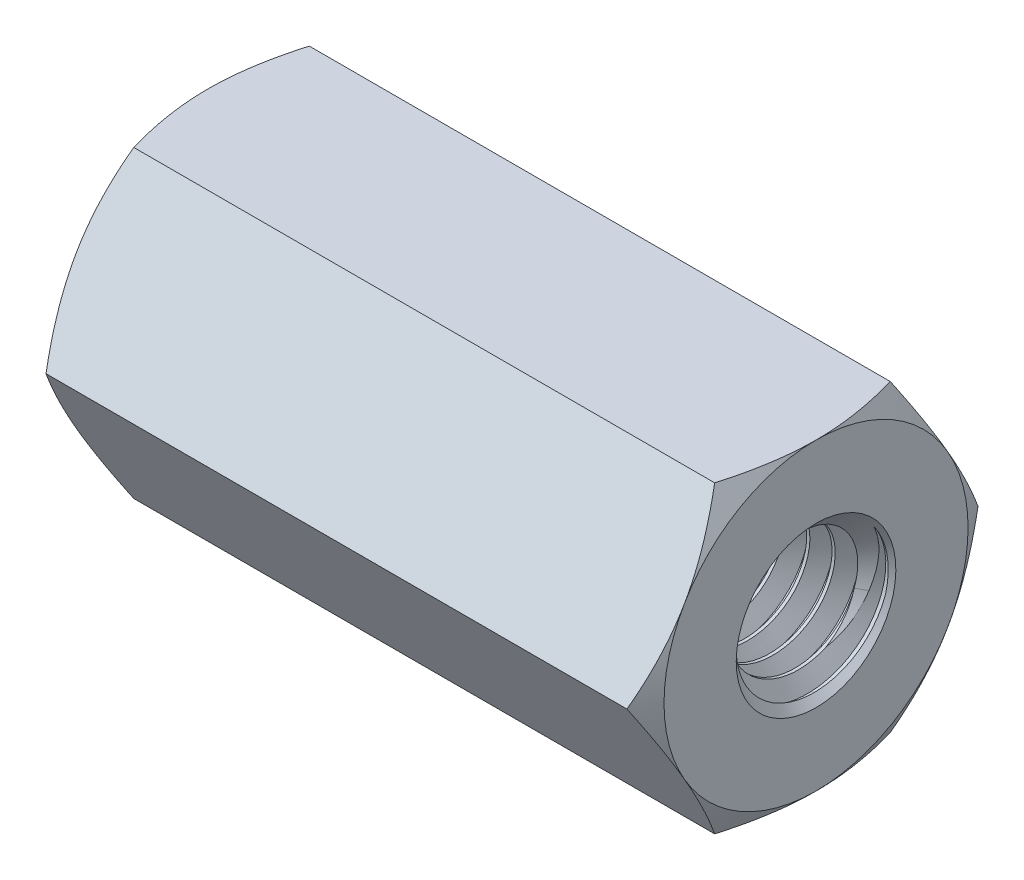
from build123d import *
from build123d.topology import SkipClean

# Parameters (mm, degrees)
BOSS_EXTRUDE1_DEPTH          = 12
SKETCH4_OUTSIDE_W            = 59.91
SKETCH4_OUTSIDE_H            = 58.982
SKETCH4_OUTSIDE_R            = 3
CUT_EXTRUDE1_DEPTH           = 13.845232579
CUT_EXTRUDE1_DRAFT           = -60
SKETCH5_OUTSIDE_W            = 59.91
SKETCH5_OUTSIDE_H            = 58.982
SKETCH5_OUTSIDE_R            = 3
CUT_EXTRUDE2_DEPTH           = 13.845232579
CUT_EXTRUDE2_DRAFT           = -60
SWEEP1_PITCH                 = 0.5
SWEEP1_HEIGHT                = 12.5
SWEEP1_RADIUS                = 1.5
SWEEP1_START_ANGLE           = -90
SKETCH8_R                    = 1.575
CUT_EXTRUDE3_OTHER_WAY_DEPTH = 14.330468218
CUT_EXTRUDE3_OTHER_WAY_TAPER = -45
SKETCH9_R                    = 1.575
CUT_EXTRUDE4_OTHER_WAY_DEPTH = 13.845232672
CUT_EXTRUDE4_OTHER_WAY_TAPER = -45


with BuildPart() as part:
    # Sketch2 → Boss-Extrude1 (new body)
    with BuildSketch(Plane(origin=(0, 0, 0), x_dir=(0, 0, -1), z_dir=(1, 0, 0))):
        Polygon((1.732050808, 3), (-1.732050808, 3), (-3.464101615, 0), (-1.732050808, -3), (1.732050808, -3), (3.464101615, 0), align=None)
    extrude(amount=BOSS_EXTRUDE1_DEPTH)

    # Sketch3 → Cut-Revolve1 (revolve, cut)
    with BuildSketch(Plane.XY, mode=Mode.PRIVATE) as cut_revolve1_sk:
        Polygon((0, 1.575), (0.075, 1.5), (11.925, 1.5), (12, 1.575), (12, 0), (0, 0), align=None)
    revolve(cut_revolve1_sk.sketch.rotate(Axis((0, 0, 0), (1, 0, 0)), 90), axis=Axis((0, 0, 0), (1, 0, 0)), mode=Mode.SUBTRACT)


with BuildPart() as cut_extrude1_tool:
    # Sketch4 outside → Cut-Extrude1 (with draft: the straight prism first)
    with BuildSketch(Plane.ZY):
        Rectangle(SKETCH4_OUTSIDE_W, SKETCH4_OUTSIDE_H)
        Circle(SKETCH4_OUTSIDE_R, mode=Mode.SUBTRACT)
    extrude(amount=-CUT_EXTRUDE1_DEPTH)
    # Cut-Extrude1: the draft: its side faces are tilted about the plane it starts from
    cut_extrude1_sides = [cut_extrude1_tool.faces().sort_by_distance(p)[0] for p in [
        (6.922616289, -29.491, 0),
        (6.922616289, 0, 29.955),
        (6.922616289, 29.491, 0),
        (6.922616289, 0, -29.955),
        (6.922616289, 0, -3),
    ]]
    draft(cut_extrude1_sides, Plane.ZY, CUT_EXTRUDE1_DRAFT)


with BuildPart() as part_1:
    add(part.part)

    # Cut-Extrude1: cut by cut_extrude1_tool
    add(cut_extrude1_tool.part, mode=Mode.SUBTRACT)


with BuildPart() as cut_extrude2_tool:
    # Sketch5 outside → Cut-Extrude2 (with draft: the straight prism first)
    with BuildSketch(Plane(origin=(12, 0, 0), x_dir=(0, 0, -1), z_dir=(1, 0, 0))):
        Rectangle(SKETCH5_OUTSIDE_W, SKETCH5_OUTSIDE_H)
        Circle(SKETCH5_OUTSIDE_R, mode=Mode.SUBTRACT)
    extrude(amount=-CUT_EXTRUDE2_DEPTH)
    # Cut-Extrude2: the draft: its side faces are tilted about the plane it starts from
    cut_extrude2_sides = [cut_extrude2_tool.faces().sort_by_distance(p)[0] for p in [
        (5.077383711, -29.491, 0),
        (5.077383711, 0, -29.955),
        (5.077383711, 29.491, 0),
        (5.077383711, 0, 29.955),
        (5.077383711, 0, 3),
    ]]
    draft(cut_extrude2_sides, Plane(origin=(12, 0, 0), x_dir=(0, 0, -1), z_dir=(1, 0, 0)), CUT_EXTRUDE2_DRAFT)


with BuildPart() as part_2:
    add(part_1.part)

    # Cut-Extrude2: cut by cut_extrude2_tool
    add(cut_extrude2_tool.part, mode=Mode.SUBTRACT)

    # Sweep1: sweep along a helix
    with BuildLine() as sweep1_path:
        add(Helix(SWEEP1_PITCH, SWEEP1_HEIGHT, SWEEP1_RADIUS, center=(0, 0, 0), direction=(1, 0, 0), mode=Mode.PRIVATE).rotate(Axis((0, 0, 0), (1, 0, 0)), SWEEP1_START_ANGLE))
    # Sketch6 → Sweep1 (sweep)
    with BuildSketch(Plane.XY):
        Polygon((-0.445873412, 1.53125), (0.018042196, 1.53125), (-0.182665608, 1.183613886), (-0.245165608, 1.183613886), align=None)
    sweep(path=sweep1_path.line, is_frenet=True)

    # Cut-Extrude3 cone 1 section (through the dimple's axis) → Cut-Extrude3 (revolve, cut)
    with BuildSketch(Plane.ZX):
        Polygon((0, 0), (1.575, 0), (0, 1.575), align=None)
    revolve(axis=Axis((0, 0, 0), (1, 0, 0)), mode=Mode.SUBTRACT)

    # Sketch8 → Cut-Extrude3 other way (cut)
    with BuildSketch(Plane.ZY):
        Circle(SKETCH8_R)
    extrude(amount=CUT_EXTRUDE3_OTHER_WAY_DEPTH, taper=CUT_EXTRUDE3_OTHER_WAY_TAPER, mode=Mode.SUBTRACT)

    # Cut-Extrude4 cone 1 section (through the dimple's axis) → Cut-Extrude4 (revolve, cut)
    with SkipClean():  # the faces are left unmerged after this step: merging them gives an invalid solid
        with BuildSketch(Plane(origin=(12, 0, 0), x_dir=(0, 0, -1), z_dir=(0, 1, 0))):
            Polygon((0, 0), (1.575, 0), (0, 1.575), align=None)
        revolve(axis=Axis((12, 0, 0), (-1, 0, 0)), mode=Mode.SUBTRACT)

    # Sketch9 → Cut-Extrude4 other way (cut)
    with SkipClean():  # the faces are left unmerged after this step: merging them gives an invalid solid
        with BuildSketch(Plane(origin=(12, 0, 0), x_dir=(0, 0, -1), z_dir=(1, 0, 0))):
            Circle(SKETCH9_R)
        extrude(amount=CUT_EXTRUDE4_OTHER_WAY_DEPTH, taper=CUT_EXTRUDE4_OTHER_WAY_TAPER, mode=Mode.SUBTRACT)


solid = part_2.part
